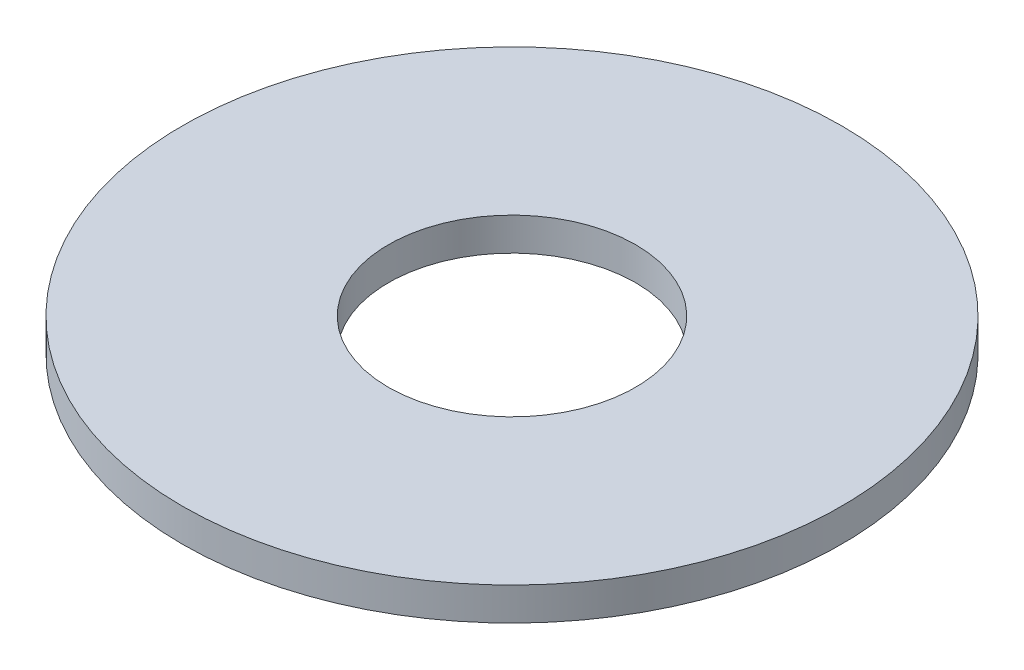
from build123d import *

# Parameters (mm, degrees)
SKETCH1_R           = 40
BOSS_EXTRUDE1_DEPTH = 4
SKETCH2_R           = 15
CUT_EXTRUDE1_DEPTH  = 57.709787515


with BuildPart() as part:
    # Sketch1 → Boss-Extrude1 (new body)
    with BuildSketch(Plane(origin=(0, 0, 0), x_dir=(1, 0, 0), z_dir=(0, 1, 0))):
        Circle(SKETCH1_R)
    extrude(amount=BOSS_EXTRUDE1_DEPTH)

    # Sketch2 → Cut-Extrude1 (cut, through all)
    with BuildSketch(Plane(origin=(0, 0, 0), x_dir=(1, 0, 0), z_dir=(0, 1, 0))):
        Circle(SKETCH2_R)
    extrude(amount=CUT_EXTRUDE1_DEPTH, mode=Mode.SUBTRACT)


solid = part.part
